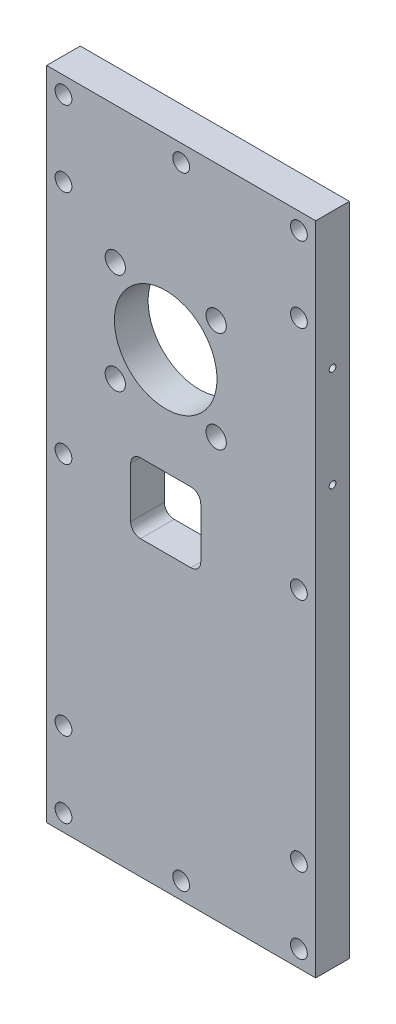
from build123d import *

# Parameters (mm, degrees)
SKIZZE1_W                       = 80
SKIZZE1_H                       = 195
AUFSATZ_LINEAR_AUSTRAGEN1_DEPTH = 10
SKIZZE2_R                       = 3.015
SKIZZE2_R_2                     = 15.25
SCHNITT_LINEAR_AUSTRAGEN1_DEPTH = 10
SKIZZE3_R                       = 1.25
SCHNITT_LINEAR_AUSTRAGEN2_DEPTH = 5
SKIZZE4_R                       = 2.5
SCHNITT_LINEAR_AUSTRAGEN3_DEPTH = 5
SKIZZE5_R                       = 1
SCHNITT_LINEAR_AUSTRAGEN4_DEPTH = 20
SCHNITT_LINEAR_START            = -30
SKIZZE6_R                       = 1
SCHNITT_LINEAR_AUSTRAGEN5_DEPTH = 30


with BuildPart() as part:
    # Skizze1 → Aufsatz-Linear austragen1 (new body)
    with BuildSketch(Plane.XY):
        with Locations((-29.059385344, -27.400468384)):
            Rectangle(SKIZZE1_W, SKIZZE1_H)
    extrude(amount=-AUFSATZ_LINEAR_AUSTRAGEN1_DEPTH)

    # Skizze2 → Schnitt-Linear austragen1 (cut)
    with BuildSketch(Plane(origin=(0, 0, -10), x_dir=(-1, 0, 0), z_dir=(0, 0, -1))):
        with Locations((18.659385344, 29.599531616)):
            Circle(SKIZZE2_R)
        with Locations((48.659385344, 29.599531616)):
            Circle(SKIZZE2_R)
        with Locations((18.659385344, -0.400468384)):
            Circle(SKIZZE2_R)
        with Locations((48.659385344, -0.400468384)):
            Circle(SKIZZE2_R)
        with Locations((33.659385344, 14.599531616)):
            Circle(SKIZZE2_R_2)
        with BuildLine():
            Line((23.241327633, -19.900468384), (23.241327633, -34.900468384))
            ThreePointArc((23.241327633, -34.900468384), (24.096006948, -36.96384678), (26.159385344, -37.818526095))
            Line((26.159385344, -37.818526095), (41.159385344, -37.818526095))
            ThreePointArc((41.159385344, -37.818526095), (43.22276374, -36.96384678), (44.077443055, -34.900468384))
            Line((44.077443055, -34.900468384), (44.077443055, -19.900468384))
            ThreePointArc((44.077443055, -19.900468384), (43.22276374, -17.837089988), (41.159385344, -16.982410673))
            Line((41.159385344, -16.982410673), (26.159385344, -16.982410673))
            ThreePointArc((26.159385344, -16.982410673), (24.096006948, -17.837089988), (23.241327633, -19.900468384))
        make_face()
    extrude(amount=-SCHNITT_LINEAR_AUSTRAGEN1_DEPTH, mode=Mode.SUBTRACT)

    # Skizze3 → Schnitt-Linear austragen2 (cut)
    with BuildSketch(Plane(origin=(0, 0, -10), x_dir=(-1, 0, 0), z_dir=(0, 0, -1))):
        with Locations((-5.940614656, 65.099531616)):
            Circle(SKIZZE3_R)
        with Locations((63.81594416, 65.099531616)):
            Circle(SKIZZE3_R)
        with Locations((28.937664752, 65.099531616)):
            Circle(SKIZZE3_R)
        with Locations((63.81594416, 42.599531616)):
            Circle(SKIZZE3_R)
        with Locations((63.81594416, -27.400468384)):
            Circle(SKIZZE3_R)
        with Locations((63.81594416, -97.400468384)):
            Circle(SKIZZE3_R)
        with Locations((63.81594416, -119.900468384)):
            Circle(SKIZZE3_R)
        with Locations((28.937664752, -119.900468384)):
            Circle(SKIZZE3_R)
        with Locations((-5.940614656, -119.900468384)):
            Circle(SKIZZE3_R)
        with Locations((-5.940614656, -97.400468384)):
            Circle(SKIZZE3_R)
        with Locations((-5.940614656, -27.400468384)):
            Circle(SKIZZE3_R)
        with Locations((-5.940614656, 42.599531616)):
            Circle(SKIZZE3_R)
    extrude(amount=-SCHNITT_LINEAR_AUSTRAGEN2_DEPTH, mode=Mode.SUBTRACT)

    # Skizze4 → Schnitt-Linear austragen3 (cut)
    with BuildSketch(Plane.XY):
        with Locations((-64.059385344, 65.099531616)):
            Circle(SKIZZE4_R)
        with Locations((5.940614656, 65.099531616)):
            Circle(SKIZZE4_R)
        with Locations((5.940614656, 42.599531616)):
            Circle(SKIZZE4_R)
        with Locations((5.940614656, -27.400468384)):
            Circle(SKIZZE4_R)
        with Locations((5.940614656, -97.400468384)):
            Circle(SKIZZE4_R)
        with Locations((5.940614656, -119.900468384)):
            Circle(SKIZZE4_R)
        with Locations((-64.059385344, -119.900468384)):
            Circle(SKIZZE4_R)
        with Locations((-64.059385344, -97.400468384)):
            Circle(SKIZZE4_R)
        with Locations((-64.059385344, -27.400468384)):
            Circle(SKIZZE4_R)
        with Locations((-64.059385344, 42.599531616)):
            Circle(SKIZZE4_R)
        with Locations((-29.059385344, -119.900468384)):
            Circle(SKIZZE4_R)
        with Locations((-29.059385344, 65.099531616)):
            Circle(SKIZZE4_R)
    extrude(amount=-SCHNITT_LINEAR_AUSTRAGEN3_DEPTH, mode=Mode.SUBTRACT)

    # Skizze5 → Schnitt-Linear austragen4 (cut)
    with BuildSketch(Plane.ZY.offset(69.059385344)):
        with Locations((-5, 29.599531616)):
            Circle(SKIZZE5_R)
        with Locations((-5, -0.400468384)):
            Circle(SKIZZE5_R)
    extrude(amount=-SCHNITT_LINEAR_AUSTRAGEN4_DEPTH, mode=Mode.SUBTRACT)

    # Skizze6 → Schnitt-Linear austragen5 (cut)
    with BuildSketch(Plane(origin=(10.940614656, 0, 0), x_dir=(0, 0, -1), z_dir=(1, 0, 0)).offset(SCHNITT_LINEAR_START)):
        with Locations((5, 29.599531616)):
            Circle(SKIZZE6_R)
        with Locations((5, -0.400468384)):
            Circle(SKIZZE6_R)
    extrude(amount=SCHNITT_LINEAR_AUSTRAGEN5_DEPTH, mode=Mode.SUBTRACT)


solid = part.part
